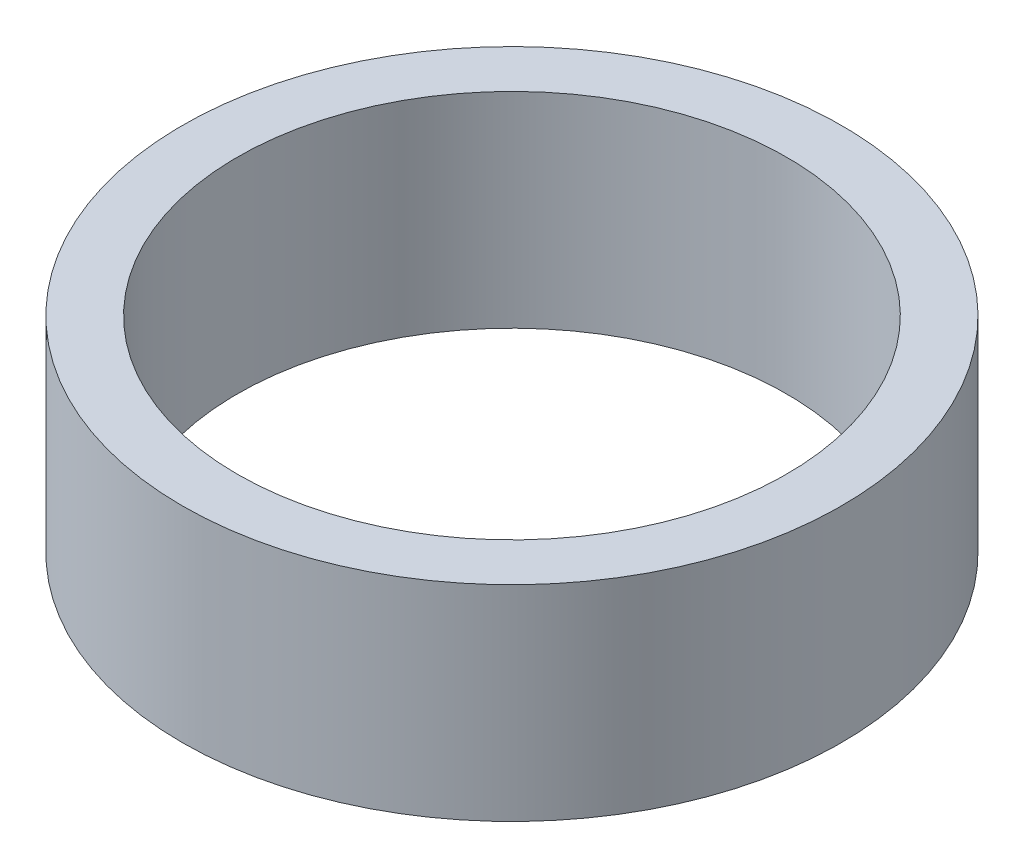
from build123d import *

# Parameters (mm, degrees)
SKETCH1_R           = 45
BOSS_EXTRUDE1_DEPTH = 28
SKETCH2_R           = 37.5
CUT_EXTRUDE1_DEPTH  = 70.526973183


with BuildPart() as part:
    # Sketch1 → Boss-Extrude1 (new body)
    with BuildSketch(Plane(origin=(0, 0, 0), x_dir=(1, 0, 0), z_dir=(0, 1, 0))):
        Circle(SKETCH1_R)
    extrude(amount=BOSS_EXTRUDE1_DEPTH)

    # Sketch2 → Cut-Extrude1 (cut, through all)
    with BuildSketch(Plane(origin=(0, 0, 0), x_dir=(1, 0, 0), z_dir=(0, 1, 0))):
        Circle(SKETCH2_R)
    extrude(amount=CUT_EXTRUDE1_DEPTH, mode=Mode.SUBTRACT)


solid = part.part
